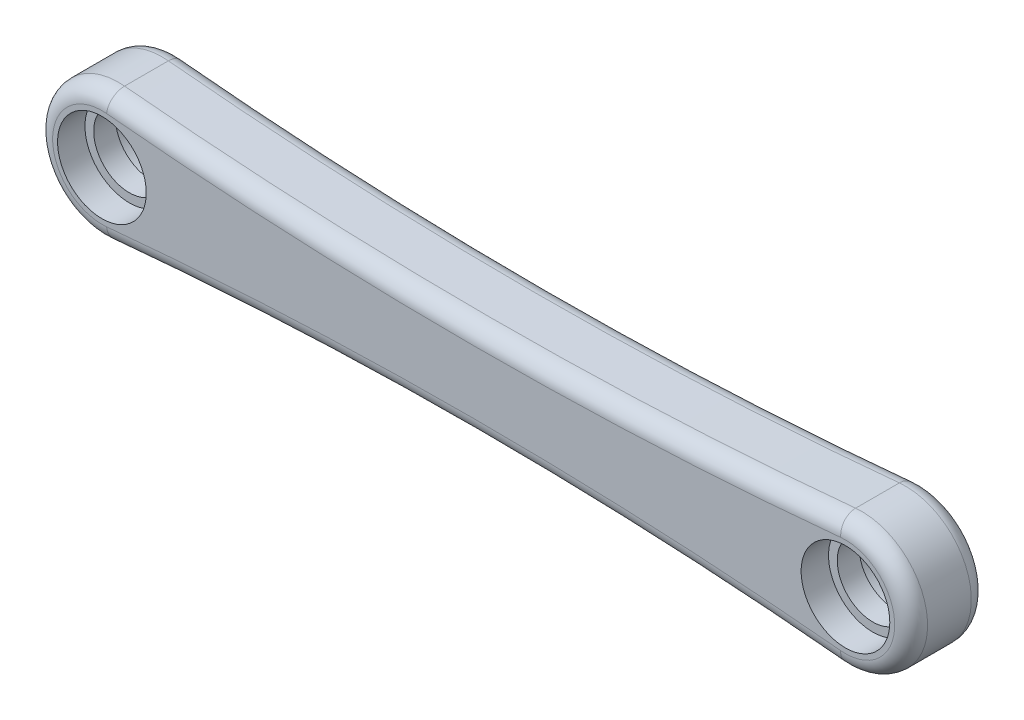
from build123d import *

# Parameters (mm, degrees)
SKETCH1_R           = 8.1
BOSS_EXTRUDE1_DEPTH = 5
SKETCH2_R           = 6.5
BOSS_EXTRUDE2_DEPTH = 2
SKETCH4_OUTSIDE_W   = 194.3
SKETCH4_OUTSIDE_H   = 58.45
CUT_EXTRUDE1_DEPTH  = 149.995377445
FILLET2_R           = 3


with BuildPart() as part:
    # Sketch1 → Boss-Extrude1 (new body)
    with BuildSketch(Plane.XY):
        with BuildLine():
            Line((0, 12), (135.85, 12))
            ThreePointArc((135.85, 12), (147.85, 0), (135.85, -12))
            Line((135.85, -12), (0, -12))
            ThreePointArc((0, -12), (-12, 0), (0, 12))
        make_face()
        Circle(SKETCH1_R, mode=Mode.SUBTRACT)
        with Locations((135.85, 0)):
            Circle(SKETCH1_R, mode=Mode.SUBTRACT)
    extrude(amount=BOSS_EXTRUDE1_DEPTH)

    # Sketch2 → Boss-Extrude2 (add)
    with BuildSketch(Plane.XY.offset(5)):
        with BuildLine():
            Line((0, -12), (135.85, -12))
            ThreePointArc((135.85, -12), (147.85, 0), (135.85, 12))
            Line((135.85, 12), (0, 12))
            ThreePointArc((0, 12), (-12, 0), (0, -12))
        make_face()
        Circle(SKETCH2_R, mode=Mode.SUBTRACT)
        with Locations((135.85, 0)):
            Circle(SKETCH2_R, mode=Mode.SUBTRACT)
    extrude(amount=BOSS_EXTRUDE2_DEPTH)

    # Mirror1: part across plane


with BuildPart() as part_1:
    add(part.part)
    add(part.part.mirror(Plane.XY.offset(7)))

    # Sketch4 outside → Cut-Extrude1 (cut, through all)
    with BuildSketch(Plane(origin=(0, 0, 0), x_dir=(-1, 0, 0), z_dir=(0, 0, -1))):
        with Locations((-67.925, 0)):
            Rectangle(SKETCH4_OUTSIDE_W, SKETCH4_OUTSIDE_H)
        with BuildLine():
            ThreePointArc((-134.705196629, 11.945267902), (-147.85, 0), (-134.705196629, -11.945267902))
            ThreePointArc((-134.705196629, -11.945267902), (-67.925, -8.752562165), (-1.144803371, -11.945267902))
            ThreePointArc((-1.144803371, -11.945267902), (12, 0), (-1.144803371, 11.945267902))
            ThreePointArc((-1.144803371, 11.945267902), (-67.925, 8.752562165), (-134.705196629, 11.945267902))
        make_face(mode=Mode.SUBTRACT)
    extrude(amount=-CUT_EXTRUDE1_DEPTH, mode=Mode.SUBTRACT)

    # Fillet2
    fillet2_edges = [part_1.edges().sort_by_distance(p)[0] for p in [
        (-12, 0, 14),
        (67.925, -8.752562165, 14),
        (147.85, 0, 14),
        (-12, 0, 0),
        (67.925, -8.752562165, 0),
        (147.85, 0, 0),
        (67.925, 8.752562165, 14),
        (67.925, 8.752562165, 0),
    ]]
    fillet(fillet2_edges, radius=FILLET2_R)


solid = part_1.part
